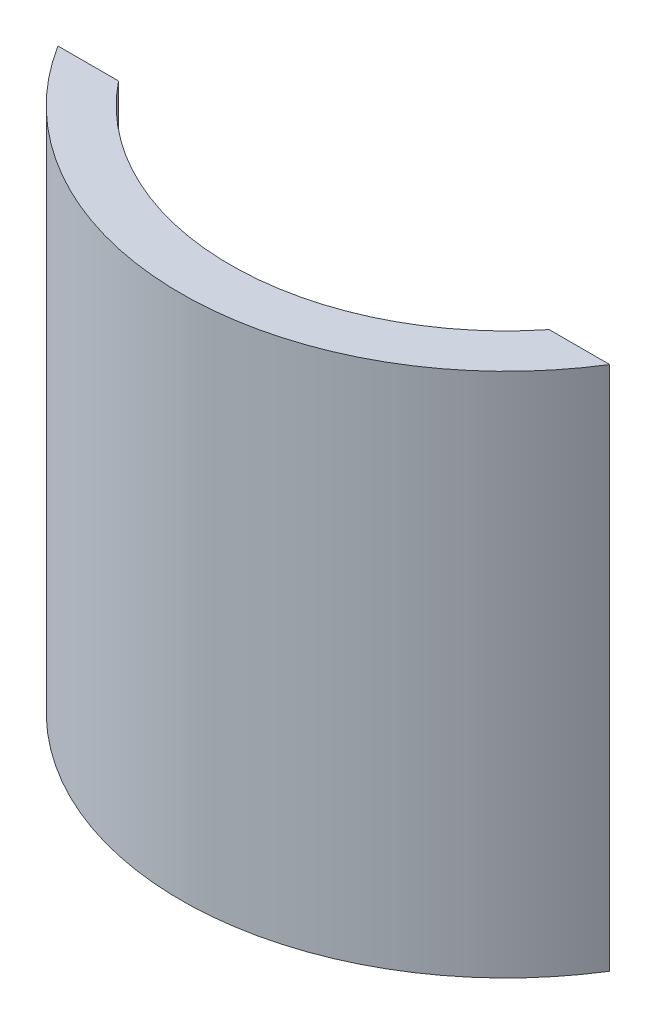
from build123d import *

# Parameters (mm, degrees)
BOSS_EXTRUDE1_DEPTH = 80


with BuildPart() as part:
    # Sketch1 → Boss-Extrude1 (new body)
    with BuildSketch(Plane(origin=(0, 0, 0), x_dir=(1, 0, 0), z_dir=(0, 1, 0))):
        with BuildLine():
            ThreePointArc((32.783823755, -26.253016969), (0, -42), (-32.783823755, -26.253016969))
            Line((-32.783823755, -26.253016969), (-42, -26.253016969))
            ThreePointArc((-42, -26.253016969), (0, -49.53), (42, -26.253016969))
            Line((42, -26.253016969), (32.783823755, -26.253016969))
        make_face()
    extrude(amount=BOSS_EXTRUDE1_DEPTH)


solid = part.part
